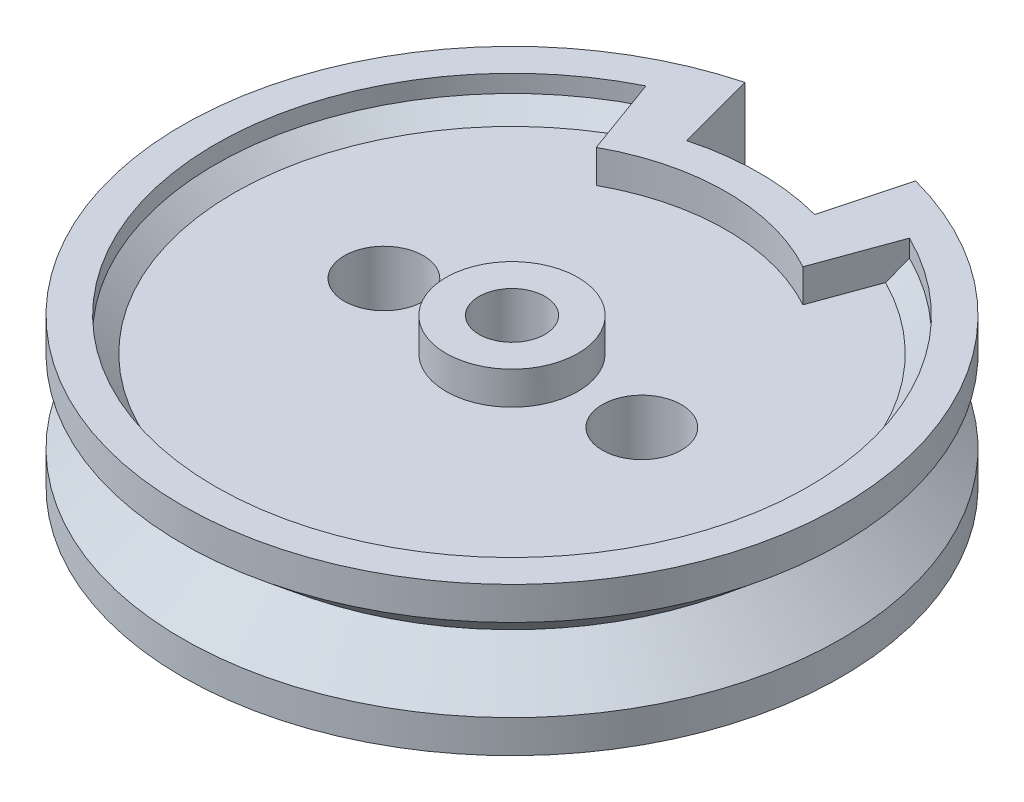
from build123d import *
from build123d.topology import SkipClean

# Parameters (mm, degrees)
CUT_EXTRUDE1_DEPTH       = 15.84082208
SHELL2_START             = 3.968374946
SHELL2_OUTLINE_R         = 2
SHELL2_DEPTH             = 0.531625054
SHELL2_START_2           = 3
SHELL2_3_DEPTH           = 0.968374946
SKETCH6_W                = 2.5
SKETCH6_H                = 4.5
SKETCH6_R                = 0.5
REVOLVE2_ANGLE           = 5
SKETCH9_R                = 0.5
REVOLVE3_ANGLE           = 5
SKETCH13_R               = 0.5
CUT_EXTRUDE3_DEPTH       = 10
CUT_EXTRUDE4_START       = -3
CUT_EXTRUDE4_OUTLINE_R   = 0.5
CUT_EXTRUDE4_DEPTH       = 3
M2_CLEARANCE_HOLE1_D     = 2.4
M2_CLEARANCE_HOLE1_DEPTH = 3.5
M2_CLEARANCE_HOLE1_TIP   = 0.721032743


with BuildPart() as part:
    # Sketch2 → Revolve1 (revolve)
    with BuildSketch(Plane.XY, mode=Mode.PRIVATE) as revolve1_sk:
        Polygon((10, 4.5), (1, 4.5), (1, 0), (10, 0), (10, 1), (8.5, 2.25), (10, 3.5), align=None)
    revolve(revolve1_sk.sketch.rotate(Axis((0, 4.5, 0), (0, -1, 0)), 90), axis=Axis((0, 4.5, 0), (0, -1, 0)))

    # Sketch3 → Cut-Extrude1 (cut, through all)
    with BuildSketch(Plane(origin=(0, 4.5, 0), x_dir=(1, 0, 0), z_dir=(0, 1, 0))):
        with BuildLine():
            Line((-3.420201433, 9.396926208), (-2.565151075, 7.047694656))
            ThreePointArc((-2.565151075, 7.047694656), (0, 7.5), (2.565151075, 7.047694656))
            Line((2.565151075, 7.047694656), (3.420201433, 9.396926208))
            ThreePointArc((3.420201433, 9.396926208), (0, 10), (-3.420201433, 9.396926208))
        make_face()
    extrude(amount=-CUT_EXTRUDE1_DEPTH, mode=Mode.SUBTRACT)

    # Shell2: read off the stored shape, not the designer's step
    # Shell2 outline → Shell2 (cut)
    with BuildSketch(Plane(origin=(0, 0, 0), x_dir=(1, 0, 0), z_dir=(0, 1, 0)).offset(SHELL2_START)):
        with BuildLine():
            Line((-3.136356765, 5.69326499), (-3.998813781, 8.062846169))
            ThreePointArc((-3.998813781, 8.062846169), (0, -9), (3.998813781, 8.062846169))
            Line((3.998813781, 8.062846169), (3.136356765, 5.69326499))
            ThreePointArc((3.136356765, 5.69326499), (0, 6.5), (-3.136356765, 5.69326499))
        make_face()
        Circle(SHELL2_OUTLINE_R, mode=Mode.SUBTRACT)
    extrude(amount=SHELL2_DEPTH, mode=Mode.SUBTRACT)

    # Shell2 2 outline → Shell2 2 (revolve, cut)
    with BuildSketch(Plane.XY):
        Polygon((2, 3.968374946), (2, 3.5), (8.437950065, 3.5), (9, 3.968374946), align=None)
    revolve(axis=Axis((0, 0, 0), (0, 1, 0)), mode=Mode.SUBTRACT)

    # Shell2 3 outline → Shell2 3 (add)
    with BuildSketch(Plane(origin=(0, 0, 0), x_dir=(1, 0, 0), z_dir=(0, 1, 0)).offset(SHELL2_START_2)):
        with BuildLine():
            Line((3.136356765, 5.69326499), (3.998813781, 8.062846169))
            ThreePointArc((3.998813781, 8.062846169), (3.54398789, 8.272856208), (3.07818129, 8.457233587))
            Line((3.07818129, 8.457233587), (2.565151075, 7.047694656))
            ThreePointArc((2.565151075, 7.047694656), (0, 7.5), (-2.565151075, 7.047694656))
            Line((-2.565151075, 7.047694656), (-3.07818129, 8.457233587))
            ThreePointArc((-3.07818129, 8.457233587), (-3.54398789, 8.272856208), (-3.998813781, 8.062846169))
            Line((-3.998813781, 8.062846169), (-3.136356765, 5.69326499))
            ThreePointArc((-3.136356765, 5.69326499), (0, 6.5), (3.136356765, 5.69326499))
        make_face()
    extrude(amount=SHELL2_3_DEPTH)

    # Sketch6 → Revolve2 (revolve)
    with BuildSketch(Plane(origin=(0, 0, 0), x_dir=(-0.3420201433256695, 0, -0.9396926207859082), z_dir=(0.9396926207859082, 0, -0.3420201433256695))):
        with Locations((8.75, 2.25)):
            Rectangle(SKETCH6_W, SKETCH6_H)
        with Locations((9, 2.25)):
            Circle(SKETCH6_R, mode=Mode.SUBTRACT)
    revolve(axis=Axis((0, 0, 0), (0, -1, 0)), revolution_arc=REVOLVE2_ANGLE)

    # Sketch9 → Revolve3 (revolve)
    with SkipClean():  # the faces are left unmerged after this step: merging them gives an invalid solid
        with BuildSketch(Plane(origin=(0, 0, 0), x_dir=(-0.3420201433256693, 0, 0.9396926207859082), z_dir=(-0.9396926207859083, 0, -0.3420201433256693))):
            Polygon((-10, 3.5), (-10, 1), (-10, 0), (-7.5, 0), (-7.5, 4.5), (-10, 4.5), align=None)
            with Locations((-9, 2.25)):
                Circle(SKETCH9_R, mode=Mode.SUBTRACT)
        revolve(axis=Axis((0, 0, 0), (0, 1, 0)), revolution_arc=REVOLVE3_ANGLE)

    # Sketch13 → Cut-Extrude3 (cut)
    with SkipClean():  # the faces are left unmerged after this step: merging them gives an invalid solid
        with BuildSketch(Plane(origin=(0, 0, 0), x_dir=(-0.25881904510252113, 0, 0.9659258262890683), z_dir=(-0.9659258262890683, 0, -0.25881904510252113))):
            with Locations((-9, 2.25)):
                Circle(SKETCH13_R)
        extrude(amount=-CUT_EXTRUDE3_DEPTH, mode=Mode.SUBTRACT)

    # Cut-Extrude4: read off the stored shape, not the designer's step
    # Cut-Extrude4 outline → Cut-Extrude4 (cut)
    with SkipClean():  # the faces are left unmerged after this step: merging them gives an invalid solid
        with BuildSketch(Plane(origin=(0, 0, 0), x_dir=(-0.25881904510252135, 0, -0.9659258262890681), z_dir=(0.9659258262890681, 0, -0.25881904510252135)).offset(CUT_EXTRUDE4_START)):
            with Locations((9, 2.25)):
                Circle(CUT_EXTRUDE4_OUTLINE_R)
        extrude(amount=CUT_EXTRUDE4_DEPTH, mode=Mode.SUBTRACT)

    # M2 Clearance Hole1
    with Locations(Plane(origin=(-3.913029006, 3.5, -0.02653295), x_dir=(0, 0, 1), z_dir=(0, 1, 0))):
        with Locations((0, 0), (0, 7.826058012)):
            Hole(M2_CLEARANCE_HOLE1_D / 2, depth=M2_CLEARANCE_HOLE1_DEPTH)
            with Locations((0, 0, -(M2_CLEARANCE_HOLE1_DEPTH + M2_CLEARANCE_HOLE1_TIP / 2))):  # 118° drill point
                Cone(0, M2_CLEARANCE_HOLE1_D / 2, M2_CLEARANCE_HOLE1_TIP, mode=Mode.SUBTRACT)


solid = part.part
